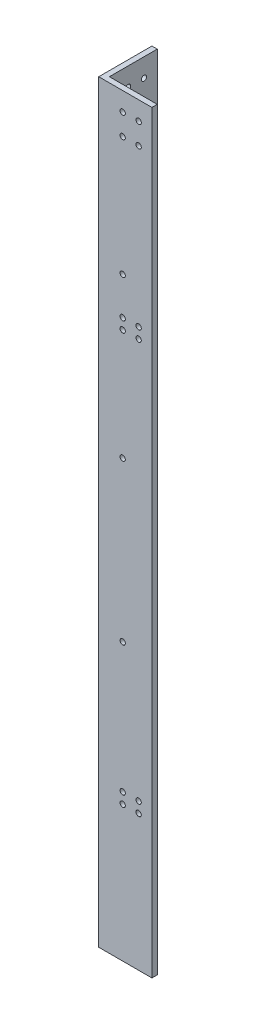
from build123d import *

# Parameters (mm, degrees)
BOSS_EXTRUDE1_DEPTH               = 450
BACKSIDEHOLES_SKETCH3_R           = 1.5875
BACKSIDEHOLES_CUT_EXTRUDE1_DEPTH  = 3.175
RIGHTSIDEHOLES_SKETCH4_R          = 1.5875
RIGHTSIDEHOLES_CUT_EXTRUDE2_DEPTH = 3.175


with BuildPart() as part:
    # Sketch2 → Boss-Extrude1 (new body)
    with BuildSketch(Plane(origin=(0, 0, 0), x_dir=(1, 0, 0), z_dir=(0, 1, 0))):
        Polygon((0, 31.75), (3.175, 31.75), (3.175, 3.175), (31.75, 3.175), (31.75, 0), (0, 0), align=None)
    extrude(amount=BOSS_EXTRUDE1_DEPTH)

    # BackSideHoles-Sketch3 → BackSideHoles-Cut-Extrude1 (cut)
    with BuildSketch(Plane.XY):
        with Locations((14.2875, 81.1125)):
            Circle(BACKSIDEHOLES_SKETCH3_R)
        with Locations((23.8125, 81.1125)):
            Circle(BACKSIDEHOLES_SKETCH3_R)
        with Locations((14.2875, 87.4625)):
            Circle(BACKSIDEHOLES_SKETCH3_R)
        with Locations((23.8125, 87.4625)):
            Circle(BACKSIDEHOLES_SKETCH3_R)
        with Locations((14.2875, 438.8875)):
            Circle(BACKSIDEHOLES_SKETCH3_R)
        with Locations((14.2875, 426.1875)):
            Circle(BACKSIDEHOLES_SKETCH3_R)
        with Locations((23.8125, 438.8875)):
            Circle(BACKSIDEHOLES_SKETCH3_R)
        with Locations((23.8125, 426.1875)):
            Circle(BACKSIDEHOLES_SKETCH3_R)
        with Locations((14.2875, 332.602644)):
            Circle(BACKSIDEHOLES_SKETCH3_R)
        with Locations((23.8125, 332.602644)):
            Circle(BACKSIDEHOLES_SKETCH3_R)
        with Locations((14.2875, 326.252644)):
            Circle(BACKSIDEHOLES_SKETCH3_R)
        with Locations((23.8125, 326.252644)):
            Circle(BACKSIDEHOLES_SKETCH3_R)
        with Locations((14.2875, 165)):
            Circle(BACKSIDEHOLES_SKETCH3_R)
        with Locations((14.2875, 260)):
            Circle(BACKSIDEHOLES_SKETCH3_R)
        with Locations((14.2875, 355)):
            Circle(BACKSIDEHOLES_SKETCH3_R)
    extrude(amount=-BACKSIDEHOLES_CUT_EXTRUDE1_DEPTH, mode=Mode.SUBTRACT)

    # RightSideHoles-Sketch4 → RightSideHoles-Cut-Extrude2 (cut)
    with BuildSketch(Plane.ZY):
        with Locations((-23.8125, 81.1125)):
            Circle(RIGHTSIDEHOLES_SKETCH4_R)
        with Locations((-14.2875, 81.1125)):
            Circle(RIGHTSIDEHOLES_SKETCH4_R)
        with Locations((-23.8125, 87.4625)):
            Circle(RIGHTSIDEHOLES_SKETCH4_R)
        with Locations((-14.2875, 87.4625)):
            Circle(RIGHTSIDEHOLES_SKETCH4_R)
        with Locations((-23.8125, 438.8875)):
            Circle(RIGHTSIDEHOLES_SKETCH4_R)
        with Locations((-14.2875, 438.8875)):
            Circle(RIGHTSIDEHOLES_SKETCH4_R)
        with Locations((-23.8125, 426.1875)):
            Circle(RIGHTSIDEHOLES_SKETCH4_R)
        with Locations((-14.2875, 426.1875)):
            Circle(RIGHTSIDEHOLES_SKETCH4_R)
        with Locations((-23.8125, 332.602644)):
            Circle(RIGHTSIDEHOLES_SKETCH4_R)
        with Locations((-14.2875, 332.602644)):
            Circle(RIGHTSIDEHOLES_SKETCH4_R)
        with Locations((-23.8125, 319.902644)):
            Circle(RIGHTSIDEHOLES_SKETCH4_R)
        with Locations((-14.2875, 319.902644)):
            Circle(RIGHTSIDEHOLES_SKETCH4_R)
        with Locations((-23.8125, 7.9375)):
            Circle(RIGHTSIDEHOLES_SKETCH4_R)
        with Locations((-14.2875, 7.9375)):
            Circle(RIGHTSIDEHOLES_SKETCH4_R)
        with Locations((-14.2875, 165)):
            Circle(RIGHTSIDEHOLES_SKETCH4_R)
        with Locations((-14.2875, 260)):
            Circle(RIGHTSIDEHOLES_SKETCH4_R)
        with Locations((-14.2875, 355)):
            Circle(RIGHTSIDEHOLES_SKETCH4_R)
    extrude(amount=-RIGHTSIDEHOLES_CUT_EXTRUDE2_DEPTH, mode=Mode.SUBTRACT)


solid = part.part
